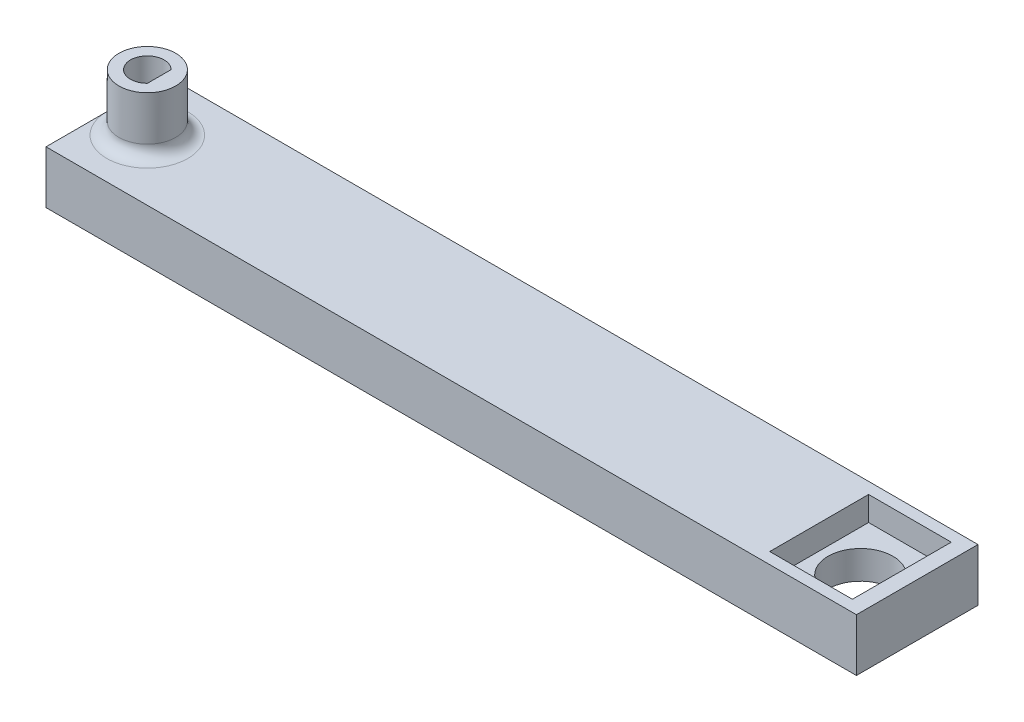
from build123d import *

# Parameters (mm, degrees)
SKETCH2_W                = 100
SKETCH2_H                = 15
BOSS_EXTRUDE1_DEPTH      = 3.25
SKETCH15_W               = 8.5
SKETCH15_H               = 4.25
SKETCH15_W_2             = 5
SKETCH15_H_2             = 3.25
CUT_EXTRUDE8_DEPTH       = 1.125
SKETCH18_W               = 10.2
SKETCH18_H               = 12.2
CUT_EXTRUDE10_DEPTH      = 3
CUT_EXTRUDE11_DEPTH      = 51.975484304
CUT_EXTRUDE11_DEPTH_BACK = 51.975484304
SKETCH19_R               = 4
SKETCH20_R               = 3.5
BOSS_EXTRUDE2_DEPTH      = 7
CUT_EXTRUDE12_DEPTH      = 9.5
FILLET1_R                = 1.5


with BuildPart() as part:
    # Sketch2 → Boss-Extrude1 (new, symmetric)
    with BuildSketch(Plane(origin=(0, 0, 0), x_dir=(1, 0, 0), z_dir=(0, 1, 0))):
        Rectangle(SKETCH2_W, SKETCH2_H)
    extrude(amount=BOSS_EXTRUDE1_DEPTH, both=True)

    # Sketch15 → Cut-Extrude8 (cut, symmetric)
    with BuildSketch(Plane.XY):
        with Locations((19.25, -1.125)):
            Rectangle(SKETCH15_W, SKETCH15_H)
        with Locations((12.5, -0.625)):
            Rectangle(SKETCH15_W_2, SKETCH15_H_2)
    extrude(amount=CUT_EXTRUDE8_DEPTH, both=True, mode=Mode.SUBTRACT)

    # Sketch18 → Cut-Extrude10 (cut)
    with BuildSketch(Plane(origin=(0, 3.25, 0), x_dir=(1, 0, 0), z_dir=(0, 1, 0))):
        with Locations((43, 0)):
            Rectangle(SKETCH18_W, SKETCH18_H)
    extrude(amount=-CUT_EXTRUDE10_DEPTH, mode=Mode.SUBTRACT)

    # Sketch19 → Cut-Extrude11 (cut, two sides: drawn at the far end of the back side and taken through both)
    with BuildSketch(Plane.XZ.offset(3.25).offset(-CUT_EXTRUDE11_DEPTH_BACK)):
        with Locations(Location((43, 0, 0), (0, 0, 270))):
            Circle(SKETCH19_R)
    extrude(amount=CUT_EXTRUDE11_DEPTH + CUT_EXTRUDE11_DEPTH_BACK, mode=Mode.SUBTRACT)

    # Sketch20 → Boss-Extrude2 (add)
    with BuildSketch(Plane(origin=(0, 3.25, 0), x_dir=(1, 0, 0), z_dir=(0, 1, 0))):
        with Locations(Location((-45, 0, 0), (0, 0, 90))):
            Circle(SKETCH20_R)
    extrude(amount=BOSS_EXTRUDE2_DEPTH)

    # Sketch21 → Cut-Extrude12 (cut)
    with BuildSketch(Plane(origin=(0, 10.25, 0), x_dir=(1, 0, 0), z_dir=(0, 1, 0))):
        with BuildLine():
            Line((-43.525, -1.459451952), (-43.525, 1.459451952))
            ThreePointArc((-43.525, 1.459451952), (-47.075, 0), (-43.525, -1.459451952))
        make_face()
    extrude(amount=-CUT_EXTRUDE12_DEPTH, mode=Mode.SUBTRACT)

    # Fillet1
    fillet1_edges = [part.edges().sort_by_distance(p)[0] for p in [
        (-45, 3.25, 3.5),
    ]]
    fillet(fillet1_edges, radius=FILLET1_R - 0.0001)  # a hair under: the kernel refuses the full size


solid = part.part
